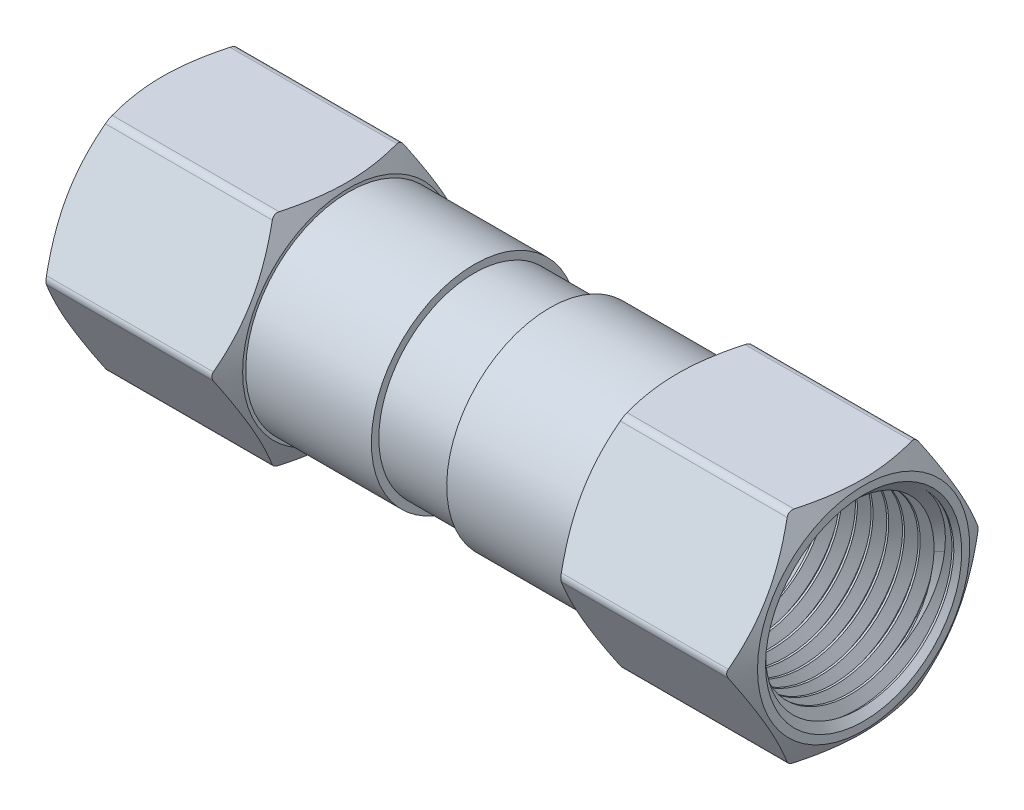
from build123d import *

# Parameters (mm, degrees)
BOSS_EXTRUDE1_START = -35.56
SKETCH2_R           = 9.525
BOSS_EXTRUDE1_DEPTH = 19.05
SKETCH3_OUTSIDE_W   = 126.81
SKETCH3_OUTSIDE_H   = 123.616
SKETCH3_OUTSIDE_R   = 10.7315
CUT_EXTRUDE1_DEPTH  = 26.453961675
CUT_EXTRUDE1_DRAFT  = -60
CUT_EXTRUDE2_START  = -19.05
SKETCH4_2_OUTSIDE_W = 192.802
SKETCH4_2_OUTSIDE_H = 189.61
SKETCH4_2_OUTSIDE_R = 10.7315
CUT_EXTRUDE2_DEPTH  = 45.503961844
CUT_EXTRUDE2_DRAFT  = 60
SKETCH6_R           = 9.652
SKETCH6_R_2         = 6.35
BOSS_EXTRUDE3_DEPTH = 31.496
SKETCH8_R           = 9.525
BOSS_EXTRUDE5_DEPTH = 12.7
SKETCH8_2_R         = 9.525
BOSS_EXTRUDE6_DEPTH = 12.7
CUT_SWEEP1_PITCH    = 1.5875
CUT_SWEEP1_TO       = 12.7
CIRPATTERN1_COUNT   = 2


with BuildPart() as part:
    # Sketch2 → Boss-Extrude1 (new body)
    with BuildSketch(Plane(origin=(0, 0, 0), x_dir=(0, 0, -1), z_dir=(1, 0, 0)).offset(BOSS_EXTRUDE1_START)):
        with BuildLine():
            Line((5.95753309, 11.1125), (-5.95753309, 11.1125))
            ThreePointArc((-5.95753309, 11.1125), (-6.35440809, 11.006157664), (-6.644940754, 10.715625))
            Line((-6.644940754, 10.715625), (-12.602473845, 0.396875))
            ThreePointArc((-12.602473845, 0.396875), (-12.70881618, 0), (-12.602473845, -0.396875))
            Line((-12.602473845, -0.396875), (-6.644940754, -10.715625))
            ThreePointArc((-6.644940754, -10.715625), (-6.35440809, -11.006157664), (-5.95753309, -11.1125))
            Line((-5.95753309, -11.1125), (5.95753309, -11.1125))
            ThreePointArc((5.95753309, -11.1125), (6.35440809, -11.006157664), (6.644940754, -10.715625))
            Line((6.644940754, -10.715625), (12.602473845, -0.396875))
            ThreePointArc((12.602473845, -0.396875), (12.70881618, 0), (12.602473845, 0.396875))
            Line((12.602473845, 0.396875), (6.644940754, 10.715625))
            ThreePointArc((6.644940754, 10.715625), (6.35440809, 11.006157664), (5.95753309, 11.1125))
        make_face()
        Circle(SKETCH2_R, mode=Mode.SUBTRACT)
    extrude(amount=BOSS_EXTRUDE1_DEPTH)


with BuildPart() as cut_extrude1_tool:
    # Sketch3 outside → Cut-Extrude1 (with draft: the straight prism first)
    with BuildSketch(Plane.ZY.offset(35.56)):
        Rectangle(SKETCH3_OUTSIDE_W, SKETCH3_OUTSIDE_H)
        Circle(SKETCH3_OUTSIDE_R, mode=Mode.SUBTRACT)
    extrude(amount=-CUT_EXTRUDE1_DEPTH)
    # Cut-Extrude1: the draft: its side faces are tilted about the plane it starts from
    cut_extrude1_sides = [cut_extrude1_tool.faces().sort_by_distance(p)[0] for p in [
        (-22.333019162, -61.808, 0),
        (-22.333019162, 0, 63.405),
        (-22.333019162, 61.808, 0),
        (-22.333019162, 0, -63.405),
        (-22.333019162, 0, -10.7315),
    ]]
    draft(cut_extrude1_sides, Plane.ZY.offset(35.56), CUT_EXTRUDE1_DRAFT)


with BuildPart() as part_1:
    add(part.part)

    # Cut-Extrude1: cut by cut_extrude1_tool
    add(cut_extrude1_tool.part, mode=Mode.SUBTRACT)


with BuildPart() as cut_extrude2_tool:
    # Sketch4<2> outside → Cut-Extrude2 (with draft: the straight prism first)
    with BuildSketch(Plane.ZY.offset(35.56).offset(CUT_EXTRUDE2_START)):
        Rectangle(SKETCH4_2_OUTSIDE_W, SKETCH4_2_OUTSIDE_H)
        Circle(SKETCH4_2_OUTSIDE_R, mode=Mode.SUBTRACT)
    extrude(amount=CUT_EXTRUDE2_DEPTH)
    # Cut-Extrude2: the draft: its side faces are tilted about the plane it starts from
    cut_extrude2_sides = [cut_extrude2_tool.faces().sort_by_distance(p)[0] for p in [
        (-39.261980922, -94.805, 0),
        (-39.261980922, 0, 96.401),
        (-39.261980922, 94.805, 0),
        (-39.261980922, 0, -96.401),
        (-39.261980922, 0, -10.7315),
    ]]
    draft(cut_extrude2_sides, Plane.ZY.offset(35.56).offset(CUT_EXTRUDE2_START), CUT_EXTRUDE2_DRAFT)


with BuildPart() as part_2:
    add(part_1.part)

    # Cut-Extrude2: cut by cut_extrude2_tool
    add(cut_extrude2_tool.part, mode=Mode.SUBTRACT)


with BuildPart() as body_2:
    # Sketch5 → Revolve1 (revolve)
    with BuildSketch(Plane.XY):
        Polygon((-22.86, 9.525), (-16.51, 9.525), (-16.51, 10.414), (-3.81, 10.414), (-3.81, 9.652), (-15.748, 9.652), (-15.748, 6.35), (-18.815167384, 6.35), (-22.86, 9.398), align=None)
    revolve(axis=Axis((35.56, 0, 0), (-1, 0, 0)))


with BuildPart() as body_3:
    # Mirror1: mirrored copy
    add(body_2.part.mirror(Plane(origin=(0, 0, 0), x_dir=(0, 0, 1), z_dir=(1, 0, 0))))


with BuildPart() as body_4:
    # Mirror1 2: mirrored copy
    add(part_2.part.mirror(Plane(origin=(0, 0, 0), x_dir=(0, 0, 1), z_dir=(1, 0, 0))))


with BuildPart() as body_5:
    # Sketch6 → Boss-Extrude3 (new body)
    with BuildSketch(Plane(origin=(-15.748, 0, 0), x_dir=(0, 0, -1), z_dir=(1, 0, 0))):
        with Locations(Location((0, 0, 0), (0, 0, 270))):
            Circle(SKETCH6_R)
        with Locations(Location((0, 0, 0), (0, 0, 270))):
            Circle(SKETCH6_R_2, mode=Mode.SUBTRACT)
    extrude(amount=BOSS_EXTRUDE3_DEPTH)


with BuildPart() as body_6:
    # Sketch8 → Boss-Extrude5 (new body)
    with BuildSketch(Plane.ZY.offset(35.56)):
        with Locations(Location((0, 0, 0), (0, 0, 90))):
            Circle(SKETCH8_R)
    extrude(amount=-BOSS_EXTRUDE5_DEPTH)

    # Cut-Sweep1: arcs per turn and ends read off the stored shape
    # Cut-Sweep1: the profile of Sketch10 screwed along a right-hand helix through 10 turns, 8 arcs to a turn; built about Z, then put on its axis
    cut_sweep1_z = Axis((0, 0, 0), (0, 0, 1))
    cut_sweep1_corners = [(8.493888504, 0, -2.38125), (8.493888504, 0, -2.1828125), (9.610925958, 0, -1.537890625), (9.610925958, 0, -3.026171875)]
    with BuildLine(mode=Mode.PRIVATE) as cut_sweep1_profile:
        Line(cut_sweep1_corners[0], cut_sweep1_corners[1])
        Line(cut_sweep1_corners[1], cut_sweep1_corners[2])
        Line(cut_sweep1_corners[2], cut_sweep1_corners[3])
        Line(cut_sweep1_corners[3], cut_sweep1_corners[0])
    cut_sweep1_cap = Face(cut_sweep1_profile.wire())
    cut_sweep1_turn_angles = [0, 22.5, 45, 67.5, 90, 112.5, 135, 157.5, 180, 202.5, 225, 247.5, 270, 292.5, 315, 337.5, 360]
    cut_sweep1_turn_weights = [1, 0.9238795325112867, 1, 0.9238795325112867, 1, 0.9238795325112867, 1, 0.9238795325112867, 1, 0.9238795325112867, 1, 0.9238795325112867, 1, 0.9238795325112867, 1, 0.9238795325112867, 1]
    cut_sweep1_turn_rails = [Edge.make_bspline([Vector(p[0], p[1], 0).rotate(cut_sweep1_z, cut_sweep1_turn_angles[k]) / cut_sweep1_turn_weights[k] + Vector(0, 0, p[2] + CUT_SWEEP1_PITCH * cut_sweep1_turn_angles[k] / 360) for k in range(17)], [0, 0, 0, 1, 1, 2, 2, 3, 3, 4, 4, 5, 5, 6, 6, 7, 7, 8, 8, 8], 2, cut_sweep1_turn_weights) for p in cut_sweep1_corners]
    cut_sweep1_turn_sides = [Face.make_surface_from_curves(cut_sweep1_turn_rails[p[0]], cut_sweep1_turn_rails[p[1]]) for p in [(0, 1), (1, 2), (2, 3), (3, 0)]]
    cut_sweep1 = Plane(origin=(-35.56, 0, 0), x_dir=(0, 1, 0), z_dir=(1, 0, 0)) * split(Solid(Shell([*[p.moved(Location((0, 0, CUT_SWEEP1_PITCH * i))) for i in range(10) for p in cut_sweep1_turn_sides], cut_sweep1_cap, cut_sweep1_cap.rotate(cut_sweep1_z, 3600).moved(Location((0, 0, CUT_SWEEP1_PITCH * 3600 / 360)))])), bisect_by=Plane.XY.offset(CUT_SWEEP1_TO), keep=Keep.BOTTOM, mode=Mode.PRIVATE)
    add(cut_sweep1, mode=Mode.SUBTRACT)


with BuildPart() as part_3:
    add(part_2.part)

    # Sketch8<2> → Boss-Extrude6 (add)
    with BuildSketch(Plane.ZY.offset(35.56)):
        with Locations(Location((0, 0, 0), (0, 0, 90))):
            Circle(SKETCH8_2_R)
    extrude(amount=-BOSS_EXTRUDE6_DEPTH)

    # Combine1: cut body 6
    add(body_6.part, mode=Mode.SUBTRACT)

    # Cut-Extrude3 cone 1 section (through the dimple's axis) → Cut-Extrude3 (revolve, cut)
    with BuildSketch(Plane(origin=(-35.56, 0, 0), x_dir=(0, 0, 1), z_dir=(0, 1, 0))):
        Polygon((0, 0), (9.921875, 0), (0, 9.921875), align=None)
    revolve(axis=Axis((-35.56, 0, 0), (1, 0, 0)), mode=Mode.SUBTRACT)


with BuildPart() as cirpattern1_1:
    # CirPattern1: pattern copy
    add(part_3.part.rotate(Axis((0, 9.652, 0), (0, -1, 0)), 1 * 360 / CIRPATTERN1_COUNT))


solid = Compound([body_2.part, body_3.part, body_5.part, part_3.part, cirpattern1_1.part])
